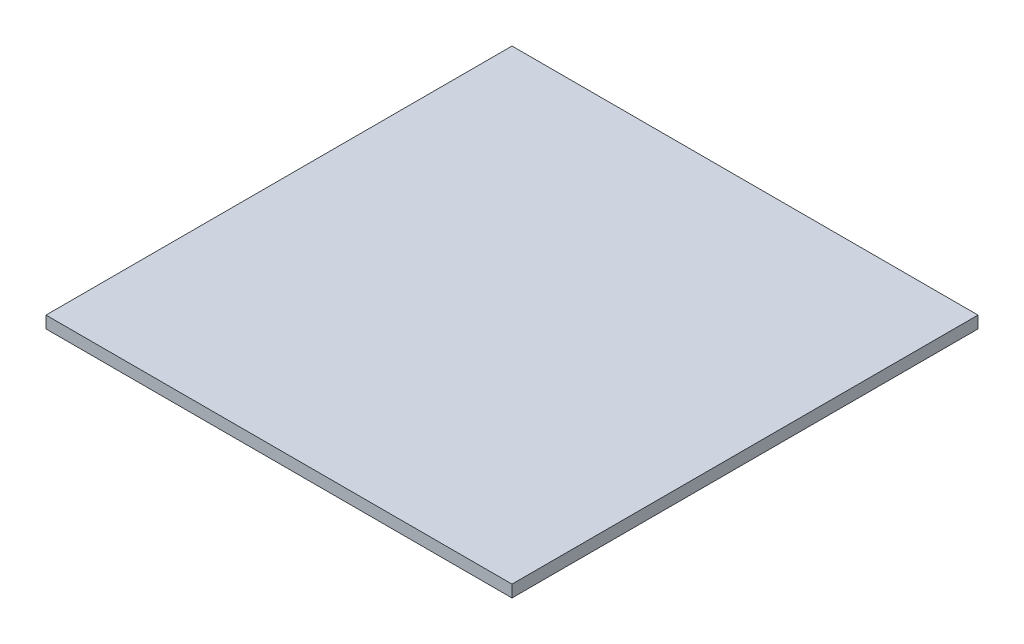
from build123d import *

# Parameters (mm, degrees)
SKETCH_1_W      = 310
SKETCH_1_H      = 310
EXTRUDE_1_DEPTH = 8


with BuildPart() as part:
    # 草图1 → 凸台-拉伸1 (new body)
    with BuildSketch(Plane(origin=(0, 0, 0), x_dir=(1, 0, 0), z_dir=(0, 1, 0))):
        with Locations((-155, 155)):
            Rectangle(SKETCH_1_W, SKETCH_1_H)
    extrude(amount=EXTRUDE_1_DEPTH)


solid = part.part
